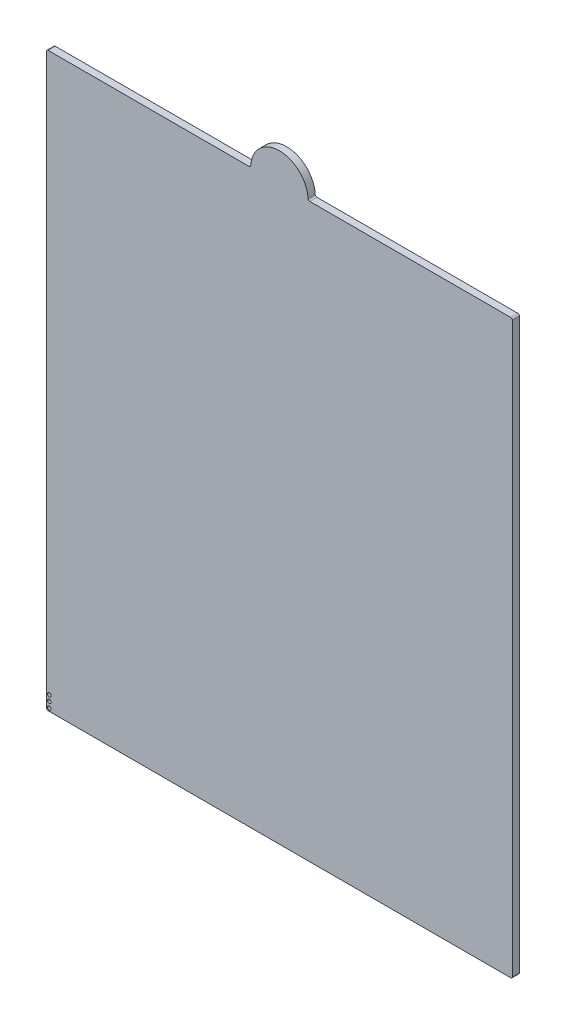
from build123d import *

# Parameters (mm, degrees)
SKETCH1_W           = 206.253
SKETCH1_H           = 253.103
BOSS_EXTRUDE1_DEPTH = 3.175
BOSS_EXTRUDE3_DEPTH = 3.175
FILLET1_R           = 0.79375
SKETCH5_R           = 0.79375
CUT_EXTRUDE1_DEPTH  = 2.54
LPATTERN1_COUNT     = 3
LPATTERN1_PITCH     = 2.54


with BuildPart() as part:
    # Sketch1 → Boss-Extrude1 (new body)
    with BuildSketch(Plane.XY):
        with Locations((103.1265, 126.5515)):
            Rectangle(SKETCH1_W, SKETCH1_H)
    extrude(amount=BOSS_EXTRUDE1_DEPTH)

    # Sketch3 → Boss-Extrude3 (add)
    with BuildSketch(Plane.XY):
        with BuildLine():
            Line((90.4265, 253.103), (115.8265, 253.103))
            ThreePointArc((115.8265, 253.103), (103.1265, 265.803), (90.4265, 253.103))
        make_face()
    extrude(amount=BOSS_EXTRUDE3_DEPTH)

    # Fillet1
    fillet1_edges = [part.edges().sort_by_distance(p)[0] for p in [
        (0, 0, 1.5875),
        (206.253, 0, 1.5875),
        (206.253, 253.103, 1.5875),
        (0, 253.103, 1.5875),
        (90.4265, 253.103, 1.5875),
        (115.8265, 253.103, 1.5875),
    ]]
    fillet(fillet1_edges, radius=FILLET1_R)

    # Sketch5 → Cut-Extrude1 (cut)
    with BuildSketch(Plane.XY.offset(3.175)):
        with Locations((1.27, 1.27)):
            Circle(SKETCH5_R)
    cut_extrude1 = extrude(amount=-CUT_EXTRUDE1_DEPTH, mode=Mode.SUBTRACT)

    # LPattern1: Cut-Extrude1 ×3
    with Locations(*[(0, i * LPATTERN1_PITCH, 0) for i in range(1, LPATTERN1_COUNT)]):
        add(cut_extrude1, mode=Mode.SUBTRACT)


solid = part.part
